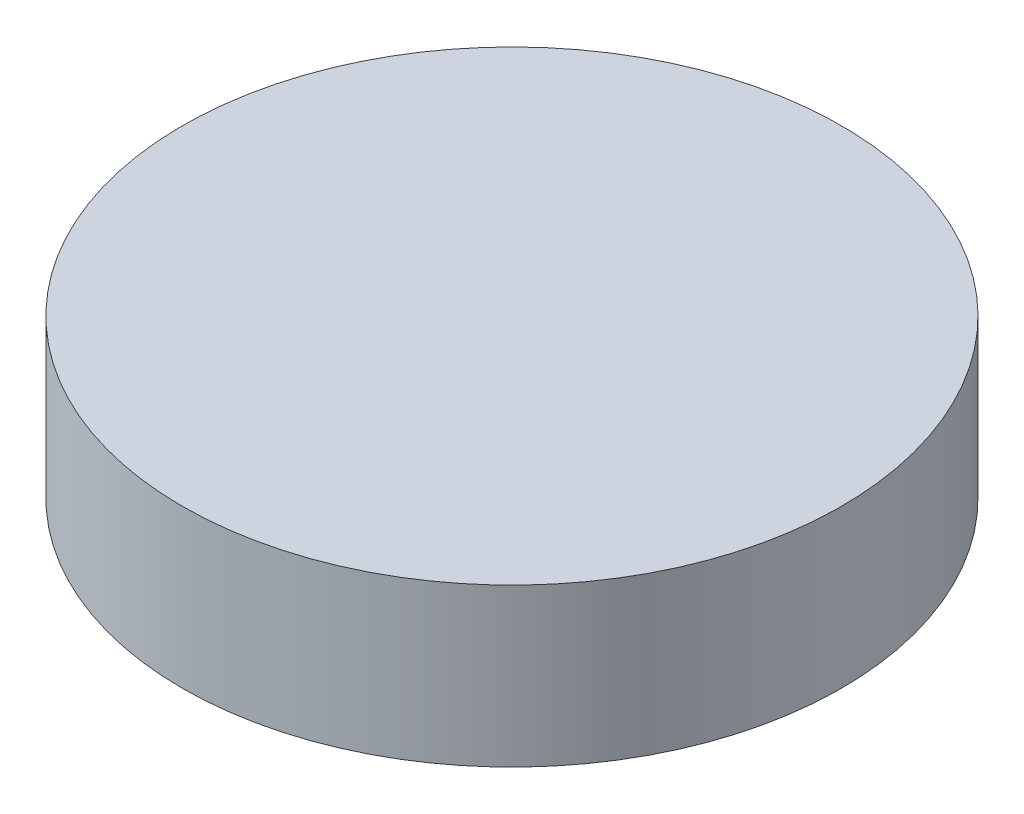
from build123d import *

# Parameters (mm, degrees)
SKETCH1_R           = 10.325
BOSS_EXTRUDE1_DEPTH = 4.938004181


with BuildPart() as part:
    # Sketch1 → Boss-Extrude1 (new body)
    with BuildSketch(Plane(origin=(0, 0, 0), x_dir=(1, 0, 0), z_dir=(0, 1, 0))):
        Circle(SKETCH1_R)
    extrude(amount=BOSS_EXTRUDE1_DEPTH)


solid = part.part
